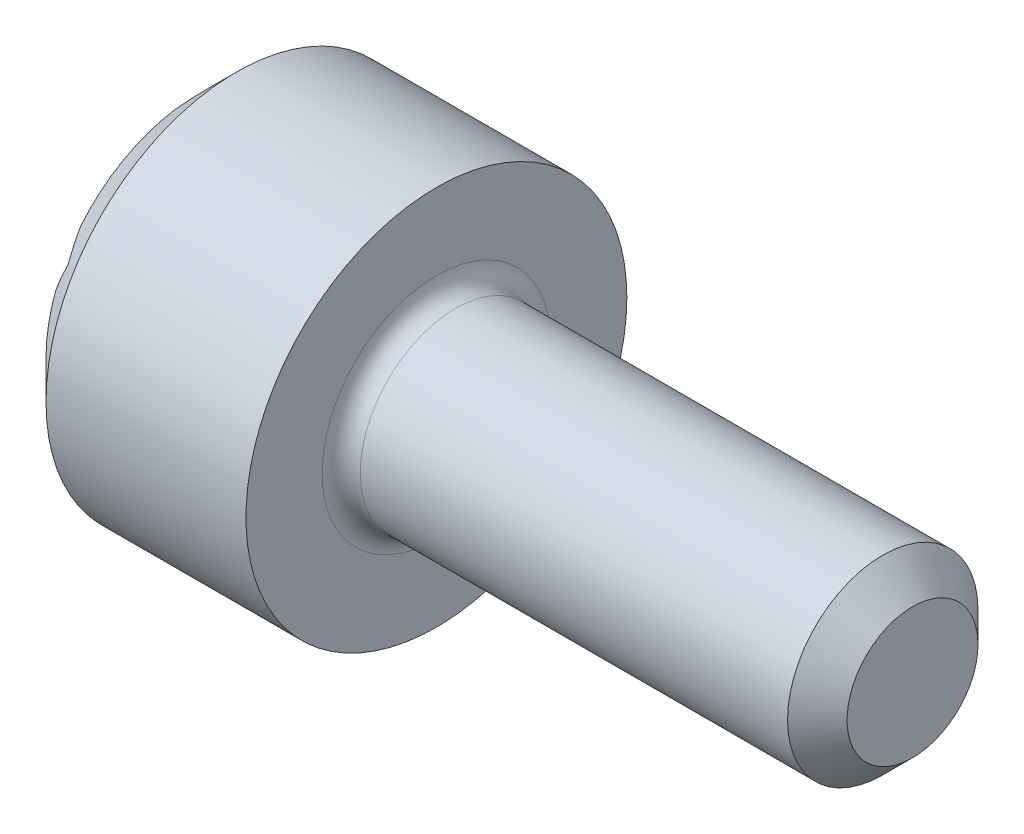
from build123d import *

# Parameters (mm, degrees)
CHAMFER1_SIZE      = 0.625
CUT_EXTRUDE1_DEPTH = 4
CHAMFER2_SIZE      = 0.8
FILLET1_R          = 0.4


with BuildPart() as part:
    # Sketch1 → Revolve1 (revolve)
    with BuildSketch(Plane(origin=(0, 0, 0), x_dir=(1, 0, 0), z_dir=(0, 1, 0))):
        Polygon((0, 0), (0, 4), (5, 4), (5, 2), (15, 2), (15, 0), align=None)
    revolve(axis=Axis((15, 0, 0), (-1, 0, 0)))

    # Chamfer1
    chamfer1_edges = [part.edges().sort_by_distance(p)[0] for p in [
        (15, 0, 2),
    ]]
    chamfer(chamfer1_edges, length=CHAMFER1_SIZE)

    # Sketch3 → Cut-Revolve1 (revolve, cut)
    with BuildSketch(Plane(origin=(0, 0, 0), x_dir=(1, 0, 0), z_dir=(0, 1, 0)), mode=Mode.PRIVATE) as cut_revolve1_sk:
        Polygon((0, 0), (5.732050808, 0), (4, 3), (0, 3), align=None)
    revolve(cut_revolve1_sk.sketch.rotate(Axis((0, 0, 0), (1, 0, 0)), 180), axis=Axis((0, 0, 0), (1, 0, 0)), mode=Mode.SUBTRACT)

    # Sketch2 → Cut-Extrude1 (cut)
    with BuildSketch(Plane.ZY):
        Polygon((0, 3.464101615), (-3, 1.732050808), (-3, -1.732050808), (0, -3.464101615), (3, -1.732050808), (3, 1.732050808), align=None)
    extrude(amount=-CUT_EXTRUDE1_DEPTH, mode=Mode.SUBTRACT)

    # Chamfer2
    # the kernel refuses this chamfer: 0.8 mm, written as the material it takes off along each edge
    with BuildSketch(Plane(origin=(0, 0, 0), x_dir=(0, 0, -1), z_dir=(0, 1, 0))) as chamfer2_piece_1:
        Polygon((4, -CHAMFER2_SIZE), (4 - CHAMFER2_SIZE, 0), (4, 0), align=None)
    revolve(axis=Axis((0, 0, 0), (-1, 0, 0)), mode=Mode.SUBTRACT)

    # Fillet1
    fillet1_edges = [part.edges().sort_by_distance(p)[0] for p in [
        (5, 0, 2),
    ]]
    fillet(fillet1_edges, radius=FILLET1_R)


solid = part.part
